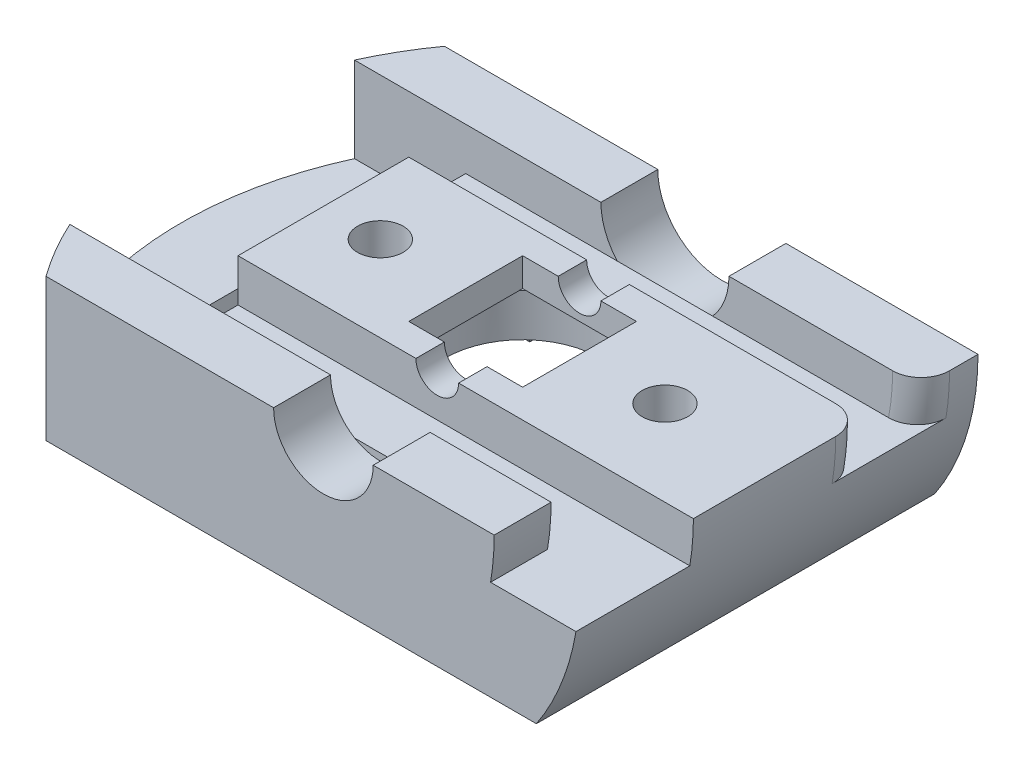
from build123d import *

# Parameters (mm, degrees)
BOSS_EXTRUDE1_DEPTH = 10
CUT_EXTRUDE3_DEPTH  = 28.676705006
CUT_EXTRUDE6_START  = -13
CUT_EXTRUDE6_DEPTH  = 2
CUT_EXTRUDE14_START = -3
CUT_EXTRUDE14_DEPTH = 2
CUT_EXTRUDE7_START  = 10
SKETCH8_R           = 2.75
CUT_EXTRUDE7_DEPTH  = 2
CUT_EXTRUDE8_START  = -16
SKETCH10_R          = 2.25
CUT_EXTRUDE8_DEPTH  = 3
CUT_EXTRUDE9_DEPTH  = 5
SKETCH18_R          = 0.75
CUT_EXTRUDE12_DEPTH = 28.676705006
CUT_EXTRUDE13_START = 5
SKETCH19_W          = 4
SKETCH19_H          = 4
CUT_EXTRUDE13_DEPTH = 1
CUT_EXTRUDE15_START = -1
SKETCH5_R           = 1.75
CUT_EXTRUDE15_DEPTH = 2
CUT_EXTRUDE16_START = -1
CUT_EXTRUDE16_DEPTH = 2
FILLET2_R           = 0.5
FILLET3_R           = 1
POT_INSERT_DEPTH    = 2.5
POT_START           = 4
SKETCH6_R           = 2.75
POT_HOLE_DEPTH      = 1.5
SCREW_START         = 11
SKETCH14_R          = 0.8
SCREW_HOLES_DEPTH   = 9
SCREW_START_2       = 10
SKETCH15_R          = 1.25
SCREW_HEADS_DEPTH   = 2
CUT_EXTRUDE11_START = 10
SKETCH13_W          = 21
SKETCH13_H          = 15
CUT_EXTRUDE11_DEPTH = 5


with BuildPart() as part:
    # Sketch1 → Boss-Extrude1 (new body)
    with BuildSketch(Plane(origin=(0, 0, 0), x_dir=(1, 0, 0), z_dir=(0, 1, 0))):
        with BuildLine():
            Line((21, 15), (21, 8))
            Line((21, 8), (21, 1))
            Line((21, 1), (12, 1))
            Line((12, 1), (2.253205655, 1))
            ThreePointArc((2.253205655, 1), (0, 8), (2.253205655, 15))
            Line((2.253205655, 15), (12, 15))
            Line((12, 15), (21, 15))
        make_face()
    extrude(amount=BOSS_EXTRUDE1_DEPTH)

    # Sketch4 → Cut-Extrude3 (cut, through all)
    with BuildSketch(Plane.XY):
        with BuildLine():
            Line((21, 14), (12, 14))
            ThreePointArc((12, 14), (18.363961031, 11.363961031), (21, 5))
            Line((21, 5), (21, 14))
        make_face()
        with BuildLine():
            Line((21, -4), (21, 5))
            ThreePointArc((21, 5), (18.363961031, -1.363961031), (12, -4))
            Line((12, -4), (21, -4))
        make_face()
    extrude(amount=-CUT_EXTRUDE3_DEPTH, mode=Mode.SUBTRACT)

    # Sketch7 → Cut-Extrude6 (cut)
    with BuildSketch(Plane.XY.offset(CUT_EXTRUDE6_START)):
        Polygon((21, 5.5), (21, 11), (10, 11), (10, 7.5), (0, 7.5), (0, 3.5), (21, 3.5), align=None)
    extrude(amount=CUT_EXTRUDE6_DEPTH, mode=Mode.SUBTRACT)

    # Sketch21 → Cut-Extrude14 (cut)
    with BuildSketch(Plane.XY.offset(CUT_EXTRUDE14_START)):
        Polygon((21, 5.5), (21, 11), (10, 11), (10, 7.5), (0, 7.5), (0, 3.5), (21, 3.5), align=None)
    extrude(amount=-CUT_EXTRUDE14_DEPTH, mode=Mode.SUBTRACT)

    # Sketch8 → Cut-Extrude7 (cut)
    with BuildSketch(Plane(origin=(0, 0, 0), x_dir=(1, 0, 0), z_dir=(0, 1, 0)).offset(CUT_EXTRUDE7_START)):
        with Locations(Location((12, 8, 0), (0, 0, 270))):
            Circle(SKETCH8_R)
    extrude(amount=-CUT_EXTRUDE7_DEPTH, mode=Mode.SUBTRACT)

    # Sketch10 → Cut-Extrude8 (cut)
    with BuildSketch(Plane.XY.offset(CUT_EXTRUDE8_START)):
        with Locations(Location((12, 5, 0), (0, 0, 221.810314896))):
            Circle(SKETCH10_R)
    extrude(amount=CUT_EXTRUDE8_DEPTH, mode=Mode.SUBTRACT)

    # Sketch11 → Cut-Extrude9 (cut)
    with BuildSketch(Plane(origin=(0, 0, 0), x_dir=(0, 0, -1), z_dir=(1, 0, 0))):
        Polygon((8, 2), (13, 2), (13, 8), (3, 8), (3, 2), align=None)
    extrude(amount=CUT_EXTRUDE9_DEPTH, mode=Mode.SUBTRACT)

    # Sketch18 → Cut-Extrude12 (cut, through all)
    with BuildSketch(Plane.XY):
        with Locations((12, 5)):
            Circle(SKETCH18_R)
    extrude(amount=-CUT_EXTRUDE12_DEPTH, mode=Mode.SUBTRACT)

    # Sketch19 → Cut-Extrude13 (cut, symmetric)
    with BuildSketch(Plane(origin=(0, 0, 0), x_dir=(1, 0, 0), z_dir=(0, 1, 0)).offset(CUT_EXTRUDE13_START)):
        with Locations((12, 8)):
            Rectangle(SKETCH19_W, SKETCH19_H)
    extrude(amount=CUT_EXTRUDE13_DEPTH, both=True, mode=Mode.SUBTRACT)

    # Sketch5 → Cut-Extrude15 (cut)
    with BuildSketch(Plane.XY.offset(CUT_EXTRUDE15_START)):
        with Locations((12, 5)):
            Circle(SKETCH5_R)
    extrude(amount=-CUT_EXTRUDE15_DEPTH, mode=Mode.SUBTRACT)

    # Sketch26 → Cut-Extrude16 (cut)
    with BuildSketch(Plane.XY.offset(CUT_EXTRUDE16_START)):
        with BuildLine():
            Line((16.483314774, 10), (19.483314774, 10))
            ThreePointArc((19.483314774, 10), (20.800790614, 6.883105034), (20.874119675, 3.5))
            Line((20.874119675, 3.5), (17.874119675, 3.5))
            ThreePointArc((17.874119675, 3.5), (17.800790614, 6.883105034), (16.483314774, 10))
        make_face()
    extrude(amount=-CUT_EXTRUDE16_DEPTH, mode=Mode.SUBTRACT)

    # Fillet2
    fillet2_edges = [part.edges().sort_by_distance(p)[0] for p in [
        (12, 8, -10.75),
    ]]
    fillet(fillet2_edges, radius=FILLET2_R)

    # Fillet3
    # the kernel refuses this fillet: 1 mm, written as the material it takes off along each edge
    with BuildSketch(Plane(origin=(12, 5, -13), x_dir=(0.6472427025312245, 0.7622839917118008, 0), z_dir=(-0.7622839917118008, 0.6472427025312245, 0))) as fillet3_piece_1_section:
        with BuildLine():
            CenterArc((9 - FILLET3_R, FILLET3_R), FILLET3_R, 270, 90)
            Line((9 - FILLET3_R, 0), (9, 0))
            Line((9, 0), (9, FILLET3_R))
        make_face()
    fillet3_piece_1 = revolve(axis=Axis((12, 5, -13), (0, 0, -1)), revolution_arc=75.177010416, mode=Mode.PRIVATE)
    fillet3_piece_1 = split(fillet3_piece_1, bisect_by=Plane(origin=(20.22008164, 3.5, -13.28352735), z_dir=(0, 1, 0)), keep=Keep.TOP, mode=Mode.PRIVATE)
    add(fillet3_piece_1, mode=Mode.SUBTRACT)
    with BuildSketch(Plane(origin=(12, 5, -11), x_dir=(0.9025022770828605, -0.43068508200337235, 0), z_dir=(-0.43068508200337235, -0.9025022770828605, 0))) as fillet3_piece_2_section:
        with BuildLine():
            CenterArc((9 - FILLET3_R, FILLET3_R), FILLET3_R, 270, 90)
            Line((9 - FILLET3_R, 0), (9, 0))
            Line((9, 0), (9, FILLET3_R))
        make_face()
    fillet3_piece_2 = revolve(axis=Axis((12, 5, -11), (0, 0, 1)), revolution_arc=75.177010416, mode=Mode.PRIVATE)
    fillet3_piece_2 = split(fillet3_piece_2, bisect_by=Plane(origin=(20.220081643, 3.5, -10.716472653), z_dir=(0, 1, 0)), keep=Keep.TOP, mode=Mode.PRIVATE)
    add(fillet3_piece_2, mode=Mode.SUBTRACT)
    with BuildSketch(Plane(origin=(21.983314774, 10, -11), x_dir=(0, 0, 1), z_dir=(-1, 0, 0))) as fillet3_piece_3:
        with BuildLine():
            CenterArc((FILLET3_R, -FILLET3_R), FILLET3_R, 90, 90)
            Line((0, -FILLET3_R), (0, 0))
            Line((0, 0), (FILLET3_R, 0))
        make_face()
    extrude(amount=11.983314774, mode=Mode.SUBTRACT)
    with BuildSketch(Plane(origin=(21.983314774, 10, -13), x_dir=(0, 0, -1), z_dir=(-1, 0, 0))) as fillet3_piece_4:
        with BuildLine():
            CenterArc((FILLET3_R, FILLET3_R), FILLET3_R, 180, 90)
            Line((0, FILLET3_R), (0, 0))
            Line((0, 0), (FILLET3_R, 0))
        make_face()
    extrude(amount=11.983314774, mode=Mode.SUBTRACT)

    # Sketch3 → Pot Insert (cut)
    with BuildSketch(Plane(origin=(28.28760271, 0, 0), x_dir=(1, 0, 0), z_dir=(0, 1, 0))):
        Polygon((-25.28760271, 12.5), (-20.53760271, 12.5), (-20.53760271, 13.5), (-16.28760271, 13.5), (-12.291072924, 13.5), (-12.291072924, 12.500096395), (-10.791072924, 9.500096395), (-9.28760271, 9.500096395), (-9.28760271, 8), (-9.28760271, 6.5), (-10.78760271, 6.5), (-12.28760271, 3.5), (-12.28760271, 2.5), (-16.28760271, 2.5), (-20.53760271, 2.5), (-20.53760271, 3.5), (-25.28760271, 3.5), (-25.28760271, 8), align=None)
    extrude(amount=POT_INSERT_DEPTH, mode=Mode.SUBTRACT)

    # Sketch6 → Pot Hole (cut)
    with BuildSketch(Plane(origin=(0, 0, 0), x_dir=(1, 0, 0), z_dir=(0, 1, 0)).offset(POT_START)):
        with Locations(Location((12, 8, 0), (0, 0, 270))):
            Circle(SKETCH6_R)
    extrude(amount=-POT_HOLE_DEPTH, mode=Mode.SUBTRACT)

    # Sketch14 → Screw Holes (cut)
    with BuildSketch(Plane(origin=(0, 0, 0), x_dir=(1, 0, 0), z_dir=(0, 1, 0)).offset(SCREW_START)):
        with Locations(Location((7, 8, 0), (0, 0, 270))):
            Circle(SKETCH14_R)
        with Locations(Location((17, 8, 0), (0, 0, 270))):
            Circle(SKETCH14_R)
    extrude(amount=-SCREW_HOLES_DEPTH, mode=Mode.SUBTRACT)

    # Sketch15 → Screw Heads (cut)
    with BuildSketch(Plane(origin=(0, 0, 0), x_dir=(1, 0, 0), z_dir=(0, 1, 0)).offset(SCREW_START_2)):
        with Locations(Location((7, 8, 0), (0, 0, 270))):
            Circle(SKETCH15_R)
        with Locations(Location((17, 8, 0), (0, 0, 270))):
            Circle(SKETCH15_R)
    extrude(amount=-SCREW_HEADS_DEPTH, mode=Mode.SUBTRACT)

    # Sketch13 → Cut-Extrude11 (cut)
    with BuildSketch(Plane(origin=(0, 0, 0), x_dir=(1, 0, 0), z_dir=(0, 1, 0)).offset(CUT_EXTRUDE11_START)):
        with Locations((10.5, 7.5)):
            Rectangle(SKETCH13_W, SKETCH13_H)
    extrude(amount=-CUT_EXTRUDE11_DEPTH, mode=Mode.SUBTRACT)


solid = part.part
